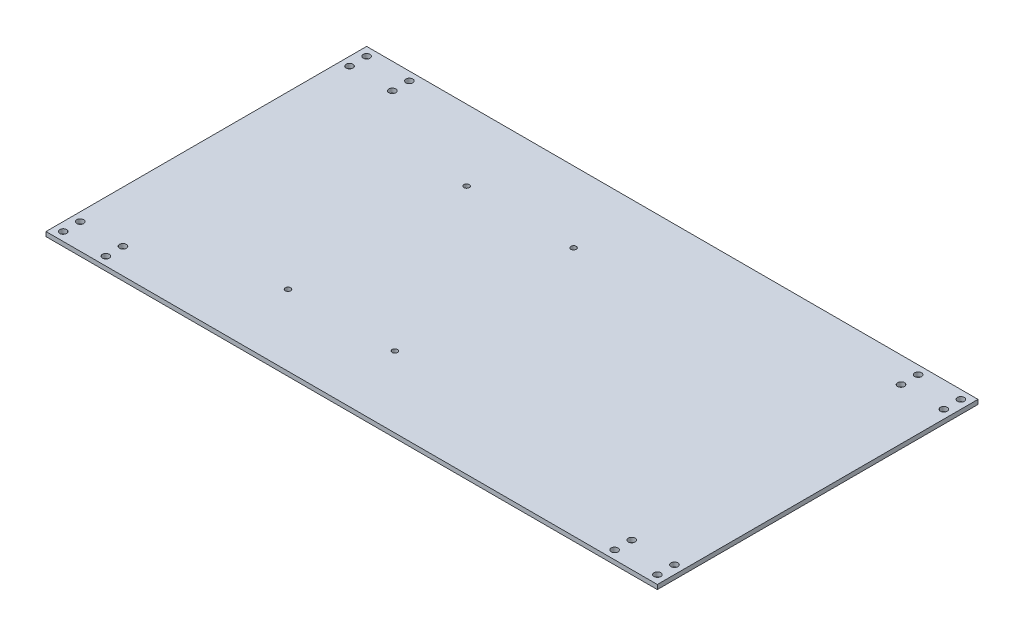
from build123d import *

# Parameters (mm, degrees)
SZKIC1_W                    = 1430
SZKIC1_H                    = 750
DODANIE_WYCI_GNI_CIE1_DEPTH = 10.4
WYTNIJ_WYCI_GNI_CIE1_REACH  = 809.439
SZKIC2_R                    = 8
SZKIC2_R_2                  = 6.25


with BuildPart() as part:
    # Szkic1 → Dodanie-wyciągnięcie1 (new body)
    with BuildSketch(Plane(origin=(0, 0, 0), x_dir=(1, 0, 0), z_dir=(0, 1, 0))):
        Rectangle(SZKIC1_W, SZKIC1_H)
    extrude(amount=DODANIE_WYCI_GNI_CIE1_DEPTH)

    # Szkic2 → Wytnij-wyciągnięcie1 (cut, up to next)
    with BuildSketch(Plane(origin=(0, 10.4, 0), x_dir=(1, 0, 0), z_dir=(0, 1, 0)), mode=Mode.PRIVATE) as wytnij_wyci_gni_cie1_sk1:
        with Locations((695, -355)):
            Circle(SZKIC2_R)
    wytnij_wyci_gni_cie1_tool1 = extrude(wytnij_wyci_gni_cie1_sk1.sketch, amount=-WYTNIJ_WYCI_GNI_CIE1_REACH, mode=Mode.PRIVATE) & part.part
    # Szkic2 → Wytnij-wyciągnięcie1 (cut, up to next)
    with BuildSketch(Plane(origin=(0, 10.4, 0), x_dir=(1, 0, 0), z_dir=(0, 1, 0)), mode=Mode.PRIVATE) as wytnij_wyci_gni_cie1_sk2:
        with Locations((695, -315)):
            Circle(SZKIC2_R)
    wytnij_wyci_gni_cie1_tool2 = extrude(wytnij_wyci_gni_cie1_sk2.sketch, amount=-WYTNIJ_WYCI_GNI_CIE1_REACH, mode=Mode.PRIVATE) & part.part
    # Szkic2 → Wytnij-wyciągnięcie1 (cut, up to next)
    with BuildSketch(Plane(origin=(0, 10.4, 0), x_dir=(1, 0, 0), z_dir=(0, 1, 0)), mode=Mode.PRIVATE) as wytnij_wyci_gni_cie1_sk3:
        with Locations((595, -355)):
            Circle(SZKIC2_R)
    wytnij_wyci_gni_cie1_tool3 = extrude(wytnij_wyci_gni_cie1_sk3.sketch, amount=-WYTNIJ_WYCI_GNI_CIE1_REACH, mode=Mode.PRIVATE) & part.part
    # Szkic2 → Wytnij-wyciągnięcie1 (cut, up to next)
    with BuildSketch(Plane(origin=(0, 10.4, 0), x_dir=(1, 0, 0), z_dir=(0, 1, 0)), mode=Mode.PRIVATE) as wytnij_wyci_gni_cie1_sk4:
        with Locations((595, -315)):
            Circle(SZKIC2_R)
    wytnij_wyci_gni_cie1_tool4 = extrude(wytnij_wyci_gni_cie1_sk4.sketch, amount=-WYTNIJ_WYCI_GNI_CIE1_REACH, mode=Mode.PRIVATE) & part.part
    # Szkic2 → Wytnij-wyciągnięcie1 (cut, up to next)
    with BuildSketch(Plane(origin=(0, 10.4, 0), x_dir=(1, 0, 0), z_dir=(0, 1, 0)), mode=Mode.PRIVATE) as wytnij_wyci_gni_cie1_sk5:
        with Locations((595, 315)):
            Circle(SZKIC2_R)
    wytnij_wyci_gni_cie1_tool5 = extrude(wytnij_wyci_gni_cie1_sk5.sketch, amount=-WYTNIJ_WYCI_GNI_CIE1_REACH, mode=Mode.PRIVATE) & part.part
    # Szkic2 → Wytnij-wyciągnięcie1 (cut, up to next)
    with BuildSketch(Plane(origin=(0, 10.4, 0), x_dir=(1, 0, 0), z_dir=(0, 1, 0)), mode=Mode.PRIVATE) as wytnij_wyci_gni_cie1_sk6:
        with Locations((595, 355)):
            Circle(SZKIC2_R)
    wytnij_wyci_gni_cie1_tool6 = extrude(wytnij_wyci_gni_cie1_sk6.sketch, amount=-WYTNIJ_WYCI_GNI_CIE1_REACH, mode=Mode.PRIVATE) & part.part
    # Szkic2 → Wytnij-wyciągnięcie1 (cut, up to next)
    with BuildSketch(Plane(origin=(0, 10.4, 0), x_dir=(1, 0, 0), z_dir=(0, 1, 0)), mode=Mode.PRIVATE) as wytnij_wyci_gni_cie1_sk7:
        with Locations((695, 315)):
            Circle(SZKIC2_R)
    wytnij_wyci_gni_cie1_tool7 = extrude(wytnij_wyci_gni_cie1_sk7.sketch, amount=-WYTNIJ_WYCI_GNI_CIE1_REACH, mode=Mode.PRIVATE) & part.part
    # Szkic2 → Wytnij-wyciągnięcie1 (cut, up to next)
    with BuildSketch(Plane(origin=(0, 10.4, 0), x_dir=(1, 0, 0), z_dir=(0, 1, 0)), mode=Mode.PRIVATE) as wytnij_wyci_gni_cie1_sk8:
        with Locations((695, 355)):
            Circle(SZKIC2_R)
    wytnij_wyci_gni_cie1_tool8 = extrude(wytnij_wyci_gni_cie1_sk8.sketch, amount=-WYTNIJ_WYCI_GNI_CIE1_REACH, mode=Mode.PRIVATE) & part.part
    # Szkic2 → Wytnij-wyciągnięcie1 (cut, up to next)
    with BuildSketch(Plane(origin=(0, 10.4, 0), x_dir=(1, 0, 0), z_dir=(0, 1, 0)), mode=Mode.PRIVATE) as wytnij_wyci_gni_cie1_sk9:
        with Locations((-695, 355)):
            Circle(SZKIC2_R)
    wytnij_wyci_gni_cie1_tool9 = extrude(wytnij_wyci_gni_cie1_sk9.sketch, amount=-WYTNIJ_WYCI_GNI_CIE1_REACH, mode=Mode.PRIVATE) & part.part
    # Szkic2 → Wytnij-wyciągnięcie1 (cut, up to next)
    with BuildSketch(Plane(origin=(0, 10.4, 0), x_dir=(1, 0, 0), z_dir=(0, 1, 0)), mode=Mode.PRIVATE) as wytnij_wyci_gni_cie1_sk10:
        with Locations((-695, 315)):
            Circle(SZKIC2_R)
    wytnij_wyci_gni_cie1_tool10 = extrude(wytnij_wyci_gni_cie1_sk10.sketch, amount=-WYTNIJ_WYCI_GNI_CIE1_REACH, mode=Mode.PRIVATE) & part.part
    # Szkic2 → Wytnij-wyciągnięcie1 (cut, up to next)
    with BuildSketch(Plane(origin=(0, 10.4, 0), x_dir=(1, 0, 0), z_dir=(0, 1, 0)), mode=Mode.PRIVATE) as wytnij_wyci_gni_cie1_sk11:
        with Locations((-595, 355)):
            Circle(SZKIC2_R)
    wytnij_wyci_gni_cie1_tool11 = extrude(wytnij_wyci_gni_cie1_sk11.sketch, amount=-WYTNIJ_WYCI_GNI_CIE1_REACH, mode=Mode.PRIVATE) & part.part
    # Szkic2 → Wytnij-wyciągnięcie1 (cut, up to next)
    with BuildSketch(Plane(origin=(0, 10.4, 0), x_dir=(1, 0, 0), z_dir=(0, 1, 0)), mode=Mode.PRIVATE) as wytnij_wyci_gni_cie1_sk12:
        with Locations((-595, 315)):
            Circle(SZKIC2_R)
    wytnij_wyci_gni_cie1_tool12 = extrude(wytnij_wyci_gni_cie1_sk12.sketch, amount=-WYTNIJ_WYCI_GNI_CIE1_REACH, mode=Mode.PRIVATE) & part.part
    # Szkic2 → Wytnij-wyciągnięcie1 (cut, up to next)
    with BuildSketch(Plane(origin=(0, 10.4, 0), x_dir=(1, 0, 0), z_dir=(0, 1, 0)), mode=Mode.PRIVATE) as wytnij_wyci_gni_cie1_sk13:
        with Locations((-595, -315)):
            Circle(SZKIC2_R)
    wytnij_wyci_gni_cie1_tool13 = extrude(wytnij_wyci_gni_cie1_sk13.sketch, amount=-WYTNIJ_WYCI_GNI_CIE1_REACH, mode=Mode.PRIVATE) & part.part
    # Szkic2 → Wytnij-wyciągnięcie1 (cut, up to next)
    with BuildSketch(Plane(origin=(0, 10.4, 0), x_dir=(1, 0, 0), z_dir=(0, 1, 0)), mode=Mode.PRIVATE) as wytnij_wyci_gni_cie1_sk14:
        with Locations((-595, -355)):
            Circle(SZKIC2_R)
    wytnij_wyci_gni_cie1_tool14 = extrude(wytnij_wyci_gni_cie1_sk14.sketch, amount=-WYTNIJ_WYCI_GNI_CIE1_REACH, mode=Mode.PRIVATE) & part.part
    # Szkic2 → Wytnij-wyciągnięcie1 (cut, up to next)
    with BuildSketch(Plane(origin=(0, 10.4, 0), x_dir=(1, 0, 0), z_dir=(0, 1, 0)), mode=Mode.PRIVATE) as wytnij_wyci_gni_cie1_sk15:
        with Locations((-695, -315)):
            Circle(SZKIC2_R)
    wytnij_wyci_gni_cie1_tool15 = extrude(wytnij_wyci_gni_cie1_sk15.sketch, amount=-WYTNIJ_WYCI_GNI_CIE1_REACH, mode=Mode.PRIVATE) & part.part
    # Szkic2 → Wytnij-wyciągnięcie1 (cut, up to next)
    with BuildSketch(Plane(origin=(0, 10.4, 0), x_dir=(1, 0, 0), z_dir=(0, 1, 0)), mode=Mode.PRIVATE) as wytnij_wyci_gni_cie1_sk16:
        with Locations((-695, -355)):
            Circle(SZKIC2_R)
    wytnij_wyci_gni_cie1_tool16 = extrude(wytnij_wyci_gni_cie1_sk16.sketch, amount=-WYTNIJ_WYCI_GNI_CIE1_REACH, mode=Mode.PRIVATE) & part.part
    # Szkic2 → Wytnij-wyciągnięcie1 (cut, up to next)
    with BuildSketch(Plane(origin=(0, 10.4, 0), x_dir=(1, 0, 0), z_dir=(0, 1, 0)), mode=Mode.PRIVATE) as wytnij_wyci_gni_cie1_sk17:
        with Locations((-315, -209)):
            Circle(SZKIC2_R_2)
    wytnij_wyci_gni_cie1_tool17 = extrude(wytnij_wyci_gni_cie1_sk17.sketch, amount=-WYTNIJ_WYCI_GNI_CIE1_REACH, mode=Mode.PRIVATE) & part.part
    # Szkic2 → Wytnij-wyciągnięcie1 (cut, up to next)
    with BuildSketch(Plane(origin=(0, 10.4, 0), x_dir=(1, 0, 0), z_dir=(0, 1, 0)), mode=Mode.PRIVATE) as wytnij_wyci_gni_cie1_sk18:
        with Locations((-65, -209)):
            Circle(SZKIC2_R_2)
    wytnij_wyci_gni_cie1_tool18 = extrude(wytnij_wyci_gni_cie1_sk18.sketch, amount=-WYTNIJ_WYCI_GNI_CIE1_REACH, mode=Mode.PRIVATE) & part.part
    # Szkic2 → Wytnij-wyciągnięcie1 (cut, up to next)
    with BuildSketch(Plane(origin=(0, 10.4, 0), x_dir=(1, 0, 0), z_dir=(0, 1, 0)), mode=Mode.PRIVATE) as wytnij_wyci_gni_cie1_sk19:
        with Locations((-65, 209)):
            Circle(SZKIC2_R_2)
    wytnij_wyci_gni_cie1_tool19 = extrude(wytnij_wyci_gni_cie1_sk19.sketch, amount=-WYTNIJ_WYCI_GNI_CIE1_REACH, mode=Mode.PRIVATE) & part.part
    # Szkic2 → Wytnij-wyciągnięcie1 (cut, up to next)
    with BuildSketch(Plane(origin=(0, 10.4, 0), x_dir=(1, 0, 0), z_dir=(0, 1, 0)), mode=Mode.PRIVATE) as wytnij_wyci_gni_cie1_sk20:
        with Locations((-315, 209)):
            Circle(SZKIC2_R_2)
    wytnij_wyci_gni_cie1_tool20 = extrude(wytnij_wyci_gni_cie1_sk20.sketch, amount=-WYTNIJ_WYCI_GNI_CIE1_REACH, mode=Mode.PRIVATE) & part.part
    add(wytnij_wyci_gni_cie1_tool1.solids().sort_by_distance((695, 10.4, 355))[0], mode=Mode.SUBTRACT)
    add(wytnij_wyci_gni_cie1_tool2.solids().sort_by_distance((695, 10.4, 315))[0], mode=Mode.SUBTRACT)
    add(wytnij_wyci_gni_cie1_tool3.solids().sort_by_distance((595, 10.4, 355))[0], mode=Mode.SUBTRACT)
    add(wytnij_wyci_gni_cie1_tool4.solids().sort_by_distance((595, 10.4, 315))[0], mode=Mode.SUBTRACT)
    add(wytnij_wyci_gni_cie1_tool5.solids().sort_by_distance((595, 10.4, -315))[0], mode=Mode.SUBTRACT)
    add(wytnij_wyci_gni_cie1_tool6.solids().sort_by_distance((595, 10.4, -355))[0], mode=Mode.SUBTRACT)
    add(wytnij_wyci_gni_cie1_tool7.solids().sort_by_distance((695, 10.4, -315))[0], mode=Mode.SUBTRACT)
    add(wytnij_wyci_gni_cie1_tool8.solids().sort_by_distance((695, 10.4, -355))[0], mode=Mode.SUBTRACT)
    add(wytnij_wyci_gni_cie1_tool9.solids().sort_by_distance((-695, 10.4, -355))[0], mode=Mode.SUBTRACT)
    add(wytnij_wyci_gni_cie1_tool10.solids().sort_by_distance((-695, 10.4, -315))[0], mode=Mode.SUBTRACT)
    add(wytnij_wyci_gni_cie1_tool11.solids().sort_by_distance((-595, 10.4, -355))[0], mode=Mode.SUBTRACT)
    add(wytnij_wyci_gni_cie1_tool12.solids().sort_by_distance((-595, 10.4, -315))[0], mode=Mode.SUBTRACT)
    add(wytnij_wyci_gni_cie1_tool13.solids().sort_by_distance((-595, 10.4, 315))[0], mode=Mode.SUBTRACT)
    add(wytnij_wyci_gni_cie1_tool14.solids().sort_by_distance((-595, 10.4, 355))[0], mode=Mode.SUBTRACT)
    add(wytnij_wyci_gni_cie1_tool15.solids().sort_by_distance((-695, 10.4, 315))[0], mode=Mode.SUBTRACT)
    add(wytnij_wyci_gni_cie1_tool16.solids().sort_by_distance((-695, 10.4, 355))[0], mode=Mode.SUBTRACT)
    add(wytnij_wyci_gni_cie1_tool17.solids().sort_by_distance((-315, 10.4, 209))[0], mode=Mode.SUBTRACT)
    add(wytnij_wyci_gni_cie1_tool18.solids().sort_by_distance((-65, 10.4, 209))[0], mode=Mode.SUBTRACT)
    add(wytnij_wyci_gni_cie1_tool19.solids().sort_by_distance((-65, 10.4, -209))[0], mode=Mode.SUBTRACT)
    add(wytnij_wyci_gni_cie1_tool20.solids().sort_by_distance((-315, 10.4, -209))[0], mode=Mode.SUBTRACT)


solid = part.part
